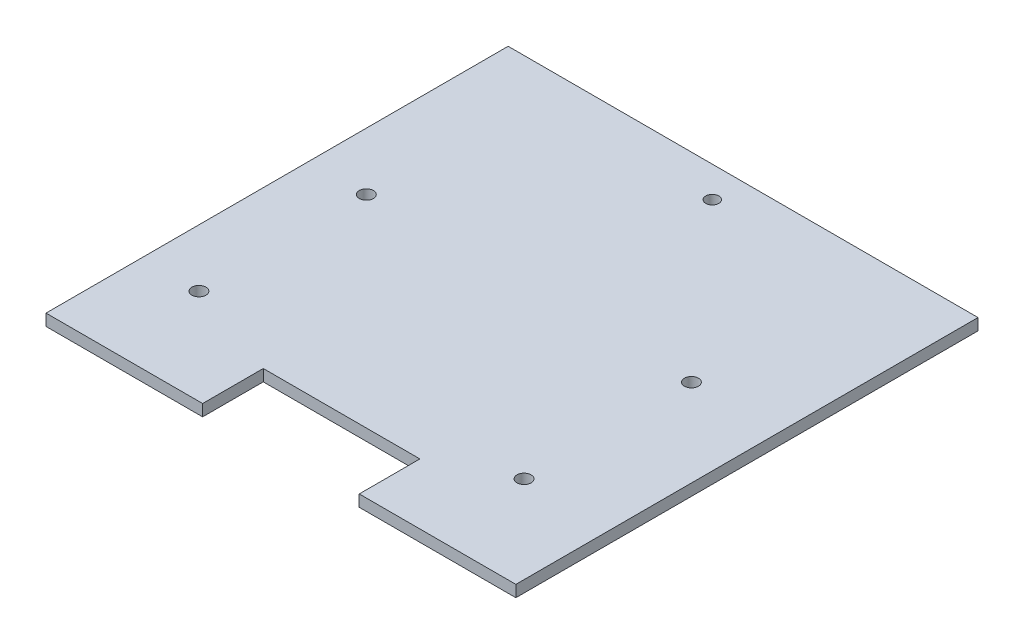
from build123d import *

# Parameters (mm, degrees)
SKETCH1_W           = 193.68
SKETCH1_H           = 190.5
BOSS_EXTRUDE1_DEPTH = 4.78
SKETCH2_R           = 2.6797
CUT_EXTRUDE1_DEPTH  = 136.916873493
CUT_EXTRUDE2_DEPTH  = 136.916873493
SKETCH4_R           = 2.893699953
CUT_EXTRUDE3_DEPTH  = 136.916873493


with BuildPart() as part:
    # Sketch1 → Boss-Extrude1 (new body)
    with BuildSketch(Plane(origin=(0, 0, 0), x_dir=(1, 0, 0), z_dir=(0, 1, 0))):
        Rectangle(SKETCH1_W, SKETCH1_H)
    extrude(amount=BOSS_EXTRUDE1_DEPTH)

    # Sketch2 → Cut-Extrude1 (cut, through all)
    with BuildSketch(Plane(origin=(0, 4.78, 0), x_dir=(1, 0, 0), z_dir=(0, 1, 0))):
        with Locations((0, 82.55)):
            Circle(SKETCH2_R)
    extrude(amount=-CUT_EXTRUDE1_DEPTH, mode=Mode.SUBTRACT)

    # Sketch3 → Cut-Extrude2 (cut, through all)
    with BuildSketch(Plane(origin=(0, 4.78, 0), x_dir=(1, 0, 0), z_dir=(0, 1, 0))):
        Polygon((0, -95.25), (-32.28, -95.25), (-32.28, -70.249999962), (32.28, -70.249999962), (32.28, -95.25), align=None)
    extrude(amount=-CUT_EXTRUDE2_DEPTH, mode=Mode.SUBTRACT)

    # Sketch4 → Cut-Extrude3 (cut, through all)
    with BuildSketch(Plane(origin=(0, 4.78, 0), x_dir=(1, 0, 0), z_dir=(0, 1, 0))):
        with Locations((-73.14, -55.899999962)):
            Circle(SKETCH4_R)
        with Locations((-73.14, 13.100000038)):
            Circle(SKETCH4_R)
        with Locations((60.86, 13.100000038)):
            Circle(SKETCH4_R)
        with Locations((60.86, -55.899999962)):
            Circle(SKETCH4_R)
    extrude(amount=-CUT_EXTRUDE3_DEPTH, mode=Mode.SUBTRACT)


solid = part.part
